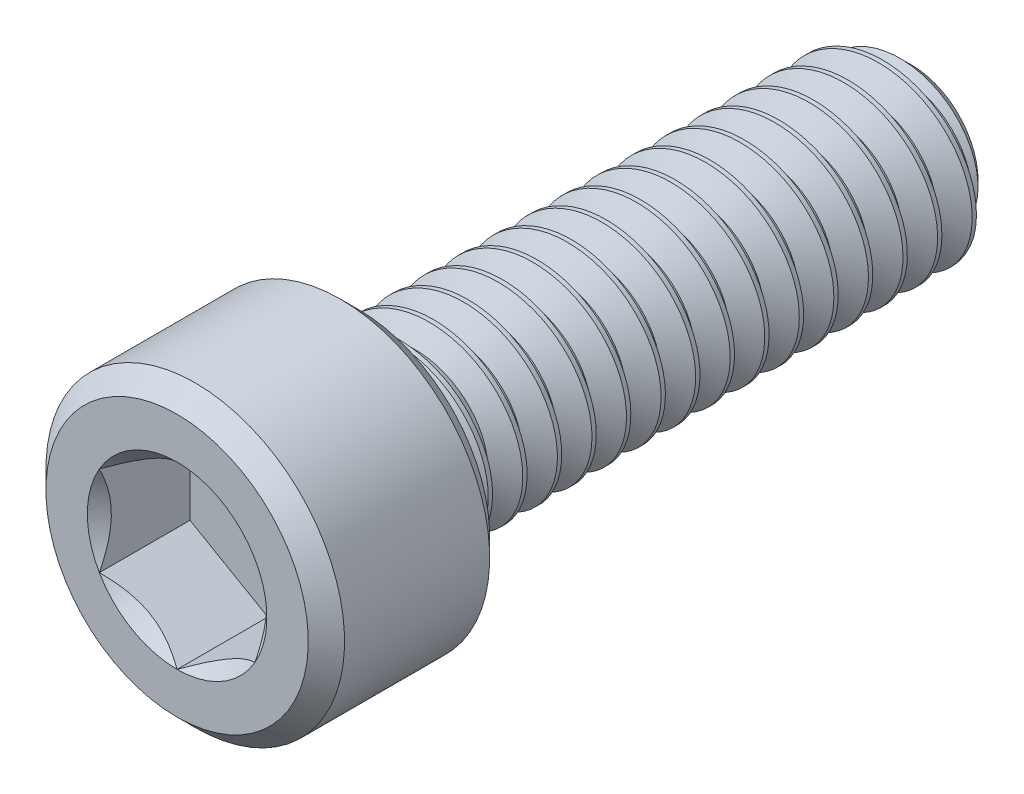
from build123d import *

# Parameters (mm, degrees)
CUT_EXTRUDE1_DEPTH = 2.0828
CUT_SWEEP1_PITCH   = 0.79375
CUT_SWEEP1_TO      = 12.7


with BuildPart() as part:
    # Sketch3 → Revolve1 (revolve)
    with BuildSketch(Plane(origin=(0, 0, 0), x_dir=(0, 0, -1), z_dir=(1, 0, 0))):
        Polygon((8.4328, 0), (-8.4328, 0), (-8.4328, 3.01244), (-8.01624, 3.429), (-4.68376, 3.429), (-4.2672, 3.01244), (-4.2672, 2.0828), (7.877175, 2.0828), (8.4328, 1.527175), align=None)
    revolve(axis=Axis((0, 0, -8.4328), (0, 0, 1)))

    # Sketch4 → Cut-Extrude1 (cut)
    with BuildSketch(Plane.XY.offset(8.4328)):
        Polygon((0, -2.062222993), (1.7859375, -1.031111496), (1.7859375, 1.031111496), (0, 2.062222993), (-1.7859375, 1.031111496), (-1.7859375, -1.031111496), align=None)
    extrude(amount=-CUT_EXTRUDE1_DEPTH, mode=Mode.SUBTRACT)

    # Cut-Extrude3 cone 1 section (through the dimple's axis) → Cut-Extrude3 (revolve, cut)
    with BuildSketch(Plane(origin=(0, 0, 8.4328), x_dir=(0, -1, 0), z_dir=(1, 0, 0))):
        Polygon((0, 0), (2.062222993, 0), (0, 2.062222993), align=None)
    revolve(axis=Axis((0, 0, 8.4328), (0, 0, -1)), mode=Mode.SUBTRACT)


with BuildPart() as body_2:
    # Split1: read off the stored shape, not the designer's step
    # Split1: the piece on the far side of the plane
    add(part.part)
    split(bisect_by=Plane.XY.offset(4.2672), keep=Keep.BOTTOM)

    # Cut-Sweep1: arcs per turn and ends read off the stored shape
    # Cut-Sweep1: the profile of Sketch7 screwed along a right-hand helix through 17 turns, 8 arcs to a turn; built about Z, then put on its axis
    cut_sweep1_z = Axis((0, 0, 0), (0, 0, 1))
    cut_sweep1_corners = [(2.125762979, 0, 0.024804687), (2.125762979, 0, -0.719335938), (1.567244252, 0, -0.396875), (1.567244252, 0, -0.29765625)]
    with BuildLine(mode=Mode.PRIVATE) as cut_sweep1_profile:
        Line(cut_sweep1_corners[0], cut_sweep1_corners[1])
        Line(cut_sweep1_corners[1], cut_sweep1_corners[2])
        Line(cut_sweep1_corners[2], cut_sweep1_corners[3])
        Line(cut_sweep1_corners[3], cut_sweep1_corners[0])
    cut_sweep1_cap = Face(cut_sweep1_profile.wire())
    cut_sweep1_turn_angles = [0, 22.5, 45, 67.5, 90, 112.5, 135, 157.5, 180, 202.5, 225, 247.5, 270, 292.5, 315, 337.5, 360]
    cut_sweep1_turn_weights = [1, 0.9238795325112867, 1, 0.9238795325112867, 1, 0.9238795325112867, 1, 0.9238795325112867, 1, 0.9238795325112867, 1, 0.9238795325112867, 1, 0.9238795325112867, 1, 0.9238795325112867, 1]
    cut_sweep1_turn_rails = [Edge.make_bspline([Vector(p[0], p[1], 0).rotate(cut_sweep1_z, cut_sweep1_turn_angles[k]) / cut_sweep1_turn_weights[k] + Vector(0, 0, p[2] + CUT_SWEEP1_PITCH * cut_sweep1_turn_angles[k] / 360) for k in range(17)], [0, 0, 0, 1, 1, 2, 2, 3, 3, 4, 4, 5, 5, 6, 6, 7, 7, 8, 8, 8], 2, cut_sweep1_turn_weights) for p in cut_sweep1_corners]
    cut_sweep1_turn_sides = [Face.make_surface_from_curves(cut_sweep1_turn_rails[p[0]], cut_sweep1_turn_rails[p[1]]) for p in [(0, 1), (1, 2), (2, 3), (3, 0)]]
    cut_sweep1 = Plane(origin=(0, 0, -8.4328), x_dir=(0, 1, 0), z_dir=(0, 0, 1)) * split(Solid(Shell([*[p.moved(Location((0, 0, CUT_SWEEP1_PITCH * i))) for i in range(17) for p in cut_sweep1_turn_sides], cut_sweep1_cap, cut_sweep1_cap.rotate(cut_sweep1_z, 6120).moved(Location((0, 0, CUT_SWEEP1_PITCH * 6120 / 360)))])), bisect_by=Plane.XY.offset(CUT_SWEEP1_TO), keep=Keep.BOTTOM, mode=Mode.PRIVATE)
    add(cut_sweep1, mode=Mode.SUBTRACT)


with BuildPart() as part_1:
    add(part.part)

    # Split1
    split(bisect_by=Plane.XY.offset(4.2672), keep=Keep.TOP)

    add(body_2.part)  # Boss-Extrude1 merges body 2
    # Boss-Extrude1: read off the stored shape, not the designer's step
    # Boss-Extrude1 outline → Boss-Extrude1 (revolve)
    with BuildSketch(Plane.XZ):
        Polygon((1.567243236, 4.2672), (1.567243236, 2.850719433), (2.0828, 4.2672), align=None)
    revolve(axis=Axis((0, 0, 0), (0, 0, 1)))


solid = part_1.part
